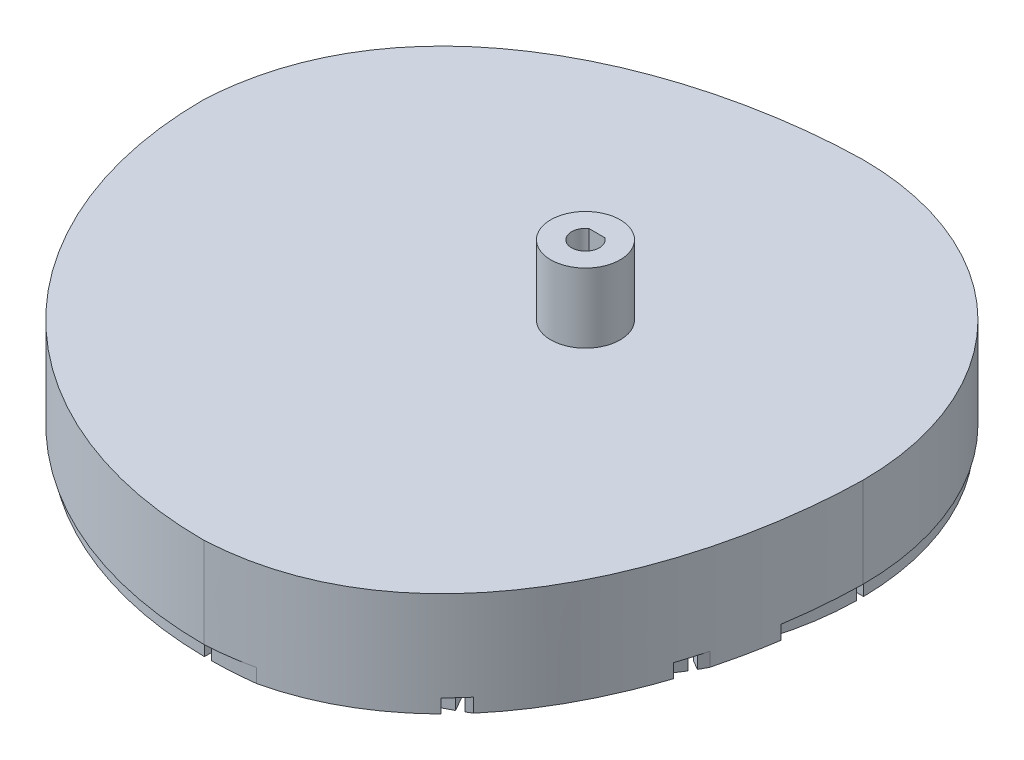
from build123d import *

# Parameters (mm, degrees)
BOSS_EXTRUDE1_DEPTH     = 19.05
SKETCH2_R               = 6.35
BOSS_EXTRUDE2_DEPTH     = 12.7
SKETCH3_R               = 2.55
CUT_EXTRUDE1_DEPTH      = 104.759855119
BOSS_EXTRUDE3_DEPTH     = 26.75
CUT_EXTRUDE_THIN1_START = -2.54
CUT_EXTRUDE_THIN1_DEPTH = 2.54


# Read off the part's stored shape, not the designer's step: Cut-Extrude-Thin1
with BuildPart() as part:
    # Sketch1 → Boss-Extrude1 (new body)
    with BuildSketch(Plane(origin=(0, 0, 0), x_dir=(1, 0, 0), z_dir=(0, 1, 0))):
        with BuildLine():
            ThreePointArc((-69.85, 0), (-49.391408666, -49.391408666), (0, -69.85))
            add(Edge.make_bspline(
                [(50.8, 0), (50.279460202, -29.873047452), (36.344280862, -68.01762427), (0, -69.85)],
                knots=[0, 0, 0, 0, 1, 1, 1, 1], degree=3))
            ThreePointArc((50.8, 0), (35.921024484, 35.921024484), (0, 50.8))
            add(Edge.make_bspline(
                [(0, 50.8), (-29.873047452, 50.279460202), (-68.01762427, 36.344280862), (-69.85, 0)],
                knots=[0, 0, 0, 0, 1, 1, 1, 1], degree=3))
        make_face()
    extrude(amount=BOSS_EXTRUDE1_DEPTH)

    # Sketch2 → Boss-Extrude2 (add)
    with BuildSketch(Plane(origin=(0, 19.05, 0), x_dir=(1, 0, 0), z_dir=(0, 1, 0))):
        with Locations(Location((0, 0, 0), (0, 0, 270))):
            Circle(SKETCH2_R)
    extrude(amount=BOSS_EXTRUDE2_DEPTH)

    # Sketch3 → Cut-Extrude1 (cut, through all)
    with BuildSketch(Plane(origin=(0, 31.75, 0), x_dir=(1, 0, 0), z_dir=(0, 1, 0))):
        with Locations(Location((0, 0, 0), (0, 0, 270))):
            Circle(SKETCH3_R)
    extrude(amount=-CUT_EXTRUDE1_DEPTH, mode=Mode.SUBTRACT)

    # Sketch4 → Boss-Extrude3 (add)
    with BuildSketch(Plane(origin=(0, 31.75, 0), x_dir=(1, 0, 0), z_dir=(0, 1, 0))):
        with BuildLine():
            Line((-1.446553711, 2.0999958), (1.446553711, 2.0999958))
            ThreePointArc((1.446553711, 2.0999958), (0, 2.55), (-1.446553711, 2.0999958))
        make_face()
    extrude(amount=-BOSS_EXTRUDE3_DEPTH)

    # Cut-Extrude-Thin1 outline → Cut-Extrude-Thin1 (cut)
    with BuildSketch(Plane.XZ.offset(CUT_EXTRUDE_THIN1_START)):
        with BuildLine():
            add(Edge.make_bspline(
                [(30.165818473, 56.638369131), (31.168790942, 55.642236718), (32.131121286, 54.602244979), (33.053679951, 53.522708536)],
                knots=[0.347768335, 0.347768335, 0.347768335, 0.347768335, 0.393679907, 0.393679907, 0.393679907, 0.393679907], degree=3))
            ThreePointArc((30.165818473, 56.638369131), (15.898442683, 62.146691954), (0.732561587, 64.120440381))
            Line((0.732561587, 64.120440381), (0.732561587, 69.200671118))
            ThreePointArc((0.732561587, 69.200671118), (4.614893677, 69.056014377), (8.482993651, 68.693756711))
            add(Edge.make_bspline(
                [(0, 69.85), (2.976299507, 69.699943406), (5.802317505, 69.306367349), (8.482993651, 68.693756711)],
                knots=[0, 0, 0, 0, 0.081891826, 0.081891826, 0.081891826, 0.081891826], degree=3))
            ThreePointArc((0, 69.85), (-49.391408666, 49.391408666), (-69.85, 0))
            add(Edge.make_bspline(
                [(-68.481907865, -9.369438989), (-69.216083506, -6.427237756), (-69.683303259, -3.306348738), (-69.85, 0)],
                knots=[0.909026987, 0.909026987, 0.909026987, 0.909026987, 1, 1, 1, 1], degree=3))
            ThreePointArc((-68.481907865, -9.369438989), (-68.936133421, -5.017929584), (-69.114525508, -0.646415977))
            Line((-69.114525508, -0.646415977), (-64.034294772, -0.646415977))
            ThreePointArc((-64.034294772, -0.646415977), (-62.00855144, -16.015445146), (-56.354390648, -30.449472976))
            add(Edge.make_bspline(
                [(-53.228297736, -33.303471373), (-54.310588659, -32.391798991), (-55.354040532, -31.440752849), (-56.354390648, -30.449472976)],
                knots=[0.602160192, 0.602160192, 0.602160192, 0.602160192, 0.647886873, 0.647886873, 0.647886873, 0.647886873], degree=3))
            ThreePointArc((-53.228297736, -33.303471373), (-53.630573063, -32.650285015), (-54.024847947, -31.992238532))
            Line((-54.024847947, -31.992238532), (-46.875388361, -27.864496116))
            ThreePointArc((-46.875388361, -27.864496116), (-39.153687302, -37.979712761), (-29.300564642, -46.033174681))
            add(Edge.make_bspline(
                [(-24.127978334, -47.532767132), (-25.864961614, -47.082337436), (-27.591730029, -46.582992367), (-29.300564642, -46.033174681)],
                knots=[0.259284817, 0.259284817, 0.259284817, 0.259284817, 0.315019687, 0.315019687, 0.315019687, 0.315019687], degree=3))
            ThreePointArc((-24.127978334, -47.532767132), (-25.079398948, -47.035625255), (-26.020622334, -46.519437529))
            Line((-26.020622334, -46.519437529), (-25.068052331, -44.869537886))
            ThreePointArc((-25.068052331, -44.869537886), (-19.171879871, -47.700490731), (-12.964117259, -49.760303108))
            add(Edge.make_bspline(
                [(0, -50.8), (-4.199209174, -50.726828507), (-8.561859636, -50.388590438), (-12.964117259, -49.760303108)],
                knots=[0, 0, 0, 0, 0.14056849, 0.14056849, 0.14056849, 0.14056849], degree=3))
            ThreePointArc((0, -50.8), (35.921024484, -35.921024484), (50.8, 0))
            add(Edge.make_bspline(
                [(49.630551123, 13.846512171), (50.342235777, 9.145233414), (50.721942371, 4.479617627), (50.8, 0)],
                knots=[0.850044839, 0.850044839, 0.850044839, 0.850044839, 1, 1, 1, 1], degree=3))
            ThreePointArc((49.630551123, 13.846512171), (47.630565062, 19.639864024), (44.955683495, 25.15419794))
            Line((44.955683495, 25.15419794), (46.605583139, 26.106767944))
            ThreePointArc((46.605583139, 26.106767944), (47.007276808, 25.378231872), (47.397559053, 24.643519424))
            add(Edge.make_bspline(
                [(45.889340146, 29.743669578), (46.440931996, 28.059281891), (46.943171743, 26.356753994), (47.397559053, 24.643519424)],
                knots=[0.680158486, 0.680158486, 0.680158486, 0.680158486, 0.735197807, 0.735197807, 0.735197807, 0.735197807], degree=3))
            ThreePointArc((45.889340146, 29.743669578), (37.912968721, 39.387151044), (27.950641726, 46.96153397))
            Line((27.950641726, 46.96153397), (32.078384142, 54.110993556))
            ThreePointArc((32.078384142, 54.110993556), (32.567364386, 53.819059882), (33.053679951, 53.522708536))
        make_face()
        with BuildLine():
            Line((-45.775459965, -27.229452161), (-44.125560322, -26.276882157))
            ThreePointArc((-44.125560322, -26.276882157), (-36.272475704, -36.381453267), (-26.167904593, -44.234537886))
            Line((-26.167904593, -44.234537886), (-27.120474597, -45.884437529))
            ThreePointArc((-27.120474597, -45.884437529), (-37.619514122, -37.728491686), (-45.775459965, -27.229452161))
        make_face(mode=Mode.SUBTRACT)
        with BuildLine():
            ThreePointArc((-54.659847947, -30.892386269), (-60.625365483, -16.282075247), (-62.764231261, -0.646415977))
            Line((-62.764231261, -0.646415977), (-54.508746428, -0.646415977))
            ThreePointArc((-54.508746428, -0.646415977), (-52.651647787, -14.14552403), (-47.510388361, -26.764643853))
            Line((-47.510388361, -26.764643853), (-54.659847947, -30.892386269))
        make_face(mode=Mode.SUBTRACT)
        with BuildLine():
            Line((-53.238658517, -0.646415977), (-51.333518511, -0.646415977))
            ThreePointArc((-51.333518511, -0.646415977), (-49.584833288, -13.323773562), (-44.760560322, -25.177029895))
            Line((-44.760560322, -25.177029895), (-46.410459965, -26.129599898))
            ThreePointArc((-46.410459965, -26.129599898), (-51.424921987, -13.816823843), (-53.238658517, -0.646415977))
        make_face(mode=Mode.SUBTRACT)
        with BuildLine():
            ThreePointArc((-43.660622109, -24.541980272), (-48.358107489, -12.995073375), (-50.063419265, -0.646415977))
            Line((-50.063419265, -0.646415977), (-2.4667076, -0.646415977))
            ThreePointArc((-2.4667076, -0.646415977), (-2.549972757, -0.011787303), (-2.472578202, 0.623584023))
            Line((-2.472578202, 0.623584023), (-50.063419265, 0.623584023))
            ThreePointArc((-50.063419265, 0.623584023), (-46.248855162, 19.185898408), (-35.82062093, 35.008740928))
            Line((-35.82062093, 35.008740928), (-2.162773151, 1.350893148))
            ThreePointArc((-2.162773151, 1.350893148), (-1.758099022, 1.84704841), (-1.242590656, 2.226761878))
            Line((-1.242590656, 2.226761878), (-34.922595318, 35.90676654))
            ThreePointArc((-34.922595318, 35.90676654), (-19.099752798, 46.335000771), (-0.537438413, 50.149564874))
            Line((-0.537438413, 50.149564874), (-0.537438413, 2.492721395))
            ThreePointArc((-0.537438413, 2.492721395), (0.100740098, 2.548009308), (0.732561587, 2.442509677))
            Line((0.732561587, 2.442509677), (0.732561587, 50.149564874))
            ThreePointArc((0.732561587, 50.149564874), (13.081218984, 48.444253099), (24.628125881, 43.746767719))
            Line((24.628125881, 43.746767719), (0.773749606, 2.429776028))
            ThreePointArc((0.773749606, 2.429776028), (1.354808059, 2.160322921), (1.85039351, 1.754577971))
            Line((1.85039351, 1.754577971), (25.727978144, 43.111767719))
            ThreePointArc((25.727978144, 43.111767719), (35.569573265, 35.460595701), (43.220745283, 25.61900058))
            Line((43.220745283, 25.61900058), (1.863055518, 1.741127261))
            ThreePointArc((1.863055518, 1.741127261), (2.238029909, 1.222179252), (2.471920537, 0.62618596))
            Line((2.471920537, 0.62618596), (43.855745283, 24.519148317))
            ThreePointArc((43.855745283, 24.519148317), (48.553230663, 12.97224142), (50.258542438, 0.623584023))
            Line((50.258542438, 0.623584023), (2.472578202, 0.623584023))
            ThreePointArc((2.472578202, 0.623584023), (2.549972757, -0.011787303), (2.4667076, -0.646415977))
            Line((2.4667076, -0.646415977), (50.258542438, -0.646415977))
            ThreePointArc((50.258542438, -0.646415977), (46.443978335, -19.208730362), (36.015744104, -35.031572882))
            Line((36.015744104, -35.031572882), (2.226761878, -1.242590656))
            ThreePointArc((2.226761878, -1.242590656), (1.84704841, -1.758099022), (1.350893148, -2.162773151))
            Line((1.350893148, -2.162773151), (35.117718492, -35.929598494))
            ThreePointArc((35.117718492, -35.929598494), (19.294875972, -46.357832726), (0.732561587, -50.172396829))
            Line((0.732561587, -50.172396829), (0.732561587, -2.442509677))
            ThreePointArc((0.732561587, -2.442509677), (0.100740098, -2.548009308), (-0.537438413, -2.492721395))
            Line((-0.537438413, -2.492721395), (-0.537438413, -50.172396829))
            ThreePointArc((-0.537438413, -50.172396829), (-12.886095811, -48.467085053), (-24.433002708, -43.769599673))
            Line((-24.433002708, -43.769599673), (-0.594312341, -2.479776772))
            ThreePointArc((-0.594312341, -2.479776772), (-1.1934905, -2.253459657), (-1.717372963, -1.884974829))
            Line((-1.717372963, -1.884974829), (-25.53285497, -43.134599673))
            ThreePointArc((-25.53285497, -43.134599673), (-35.374450091, -35.483427655), (-43.025622109, -25.641832534))
            Line((-43.025622109, -25.641832534), (-1.778253218, -1.827653001))
            ThreePointArc((-1.778253218, -1.827653001), (-2.177453235, -1.327101129), (-2.439388198, -0.742889776))
            Line((-2.439388198, -0.742889776), (-43.660622109, -24.541980272))
        make_face(mode=Mode.SUBTRACT)
        with BuildLine():
            Line((-49.291787344, 48.479907342), (-45.69952174, 44.887641738))
            ThreePointArc((-45.69952174, 44.887641738), (-59.155452231, 24.531985958), (-64.034294772, 0.623584023))
            Line((-64.034294772, 0.623584023), (-69.114525508, 0.623584023))
            ThreePointArc((-69.114525508, 0.623584023), (-63.848760256, 26.476017794), (-49.291787344, 48.479907342))
        make_face(mode=Mode.SUBTRACT)
        with BuildLine():
            ThreePointArc((-62.764231261, 0.623584023), (-57.982125224, 24.045977998), (-44.801451219, 43.989571217))
            Line((-44.801451219, 43.989571217), (-38.963941912, 38.15206191))
            ThreePointArc((-38.963941912, 38.15206191), (-50.355499684, 20.886926265), (-54.508746428, 0.623584023))
            Line((-54.508746428, 0.623584023), (-62.764231261, 0.623584023))
        make_face(mode=Mode.SUBTRACT)
        with BuildLine():
            Line((-38.065854138, 37.253974135), (-36.71871672, 35.906836718))
            ThreePointArc((-36.71871672, 35.906836718), (-47.422182168, 19.671906367), (-51.333518511, 0.623584023))
            Line((-51.333518511, 0.623584023), (-53.238658517, 0.623584023))
            ThreePointArc((-53.238658517, 0.623584023), (-49.182172677, 20.400918305), (-38.065854138, 37.253974135))
        make_face(mode=Mode.SUBTRACT)
        with BuildLine():
            Line((-0.537438413, 53.324804127), (-0.537438413, 51.41966412))
            ThreePointArc((-0.537438413, 51.41966412), (-19.585760757, 47.508327778), (-35.820691108, 36.80486233))
            Line((-35.820691108, 36.80486233), (-37.167828526, 38.151999747))
            ThreePointArc((-37.167828526, 38.151999747), (-20.314772696, 49.268318287), (-0.537438413, 53.324804127))
        make_face(mode=Mode.SUBTRACT)
        with BuildLine():
            ThreePointArc((-43.903425607, 44.887596829), (-23.959832389, 58.068270834), (-0.537438413, 62.85037687))
            Line((-0.537438413, 62.85037687), (-0.537438413, 54.594892038))
            ThreePointArc((-0.537438413, 54.594892038), (-20.800780654, 50.441645293), (-38.0659163, 39.050087522))
            Line((-38.0659163, 39.050087522), (-43.903425607, 44.887596829))
        make_face(mode=Mode.SUBTRACT)
        with BuildLine():
            Line((-0.537438413, 69.200671118), (-0.537438413, 64.120440381))
            ThreePointArc((-0.537438413, 64.120440381), (-24.445840348, 59.24159784), (-44.801496128, 45.78566735))
            Line((-44.801496128, 45.78566735), (-48.393761732, 49.377932954))
            ThreePointArc((-48.393761732, 49.377932954), (-26.389872184, 63.934905866), (-0.537438413, 69.200671118))
        make_face(mode=Mode.SUBTRACT)
        with BuildLine():
            Line((45.970583139, 27.206620206), (44.320683495, 26.254050203))
            ThreePointArc((44.320683495, 26.254050203), (36.467598877, 36.358621313), (26.363027767, 44.211705931))
            Line((26.363027767, 44.211705931), (27.31559777, 45.861605575))
            ThreePointArc((27.31559777, 45.861605575), (37.814637295, 37.705659731), (45.970583139, 27.206620206))
        make_face(mode=Mode.SUBTRACT)
        with BuildLine():
            Line((26.215745508, 46.496605575), (25.263175504, 44.846705931))
            ThreePointArc((25.263175504, 44.846705931), (13.409919172, 49.670978898), (0.732561587, 51.41966412))
            Line((0.732561587, 51.41966412), (0.732561587, 53.324804127))
            ThreePointArc((0.732561587, 53.324804127), (13.902969453, 51.511067597), (26.215745508, 46.496605575))
        make_face(mode=Mode.SUBTRACT)
        with BuildLine():
            ThreePointArc((0.732561587, 62.85037687), (16.368220857, 60.711511093), (30.978531879, 54.745993556))
            Line((30.978531879, 54.745993556), (26.850789463, 47.59653397))
            ThreePointArc((26.850789463, 47.59653397), (14.23166964, 52.737793396), (0.732561587, 54.594892038))
            Line((0.732561587, 54.594892038), (0.732561587, 62.85037687))
        make_face(mode=Mode.SUBTRACT)
    extrude(amount=CUT_EXTRUDE_THIN1_DEPTH, mode=Mode.SUBTRACT)


solid = part.part
